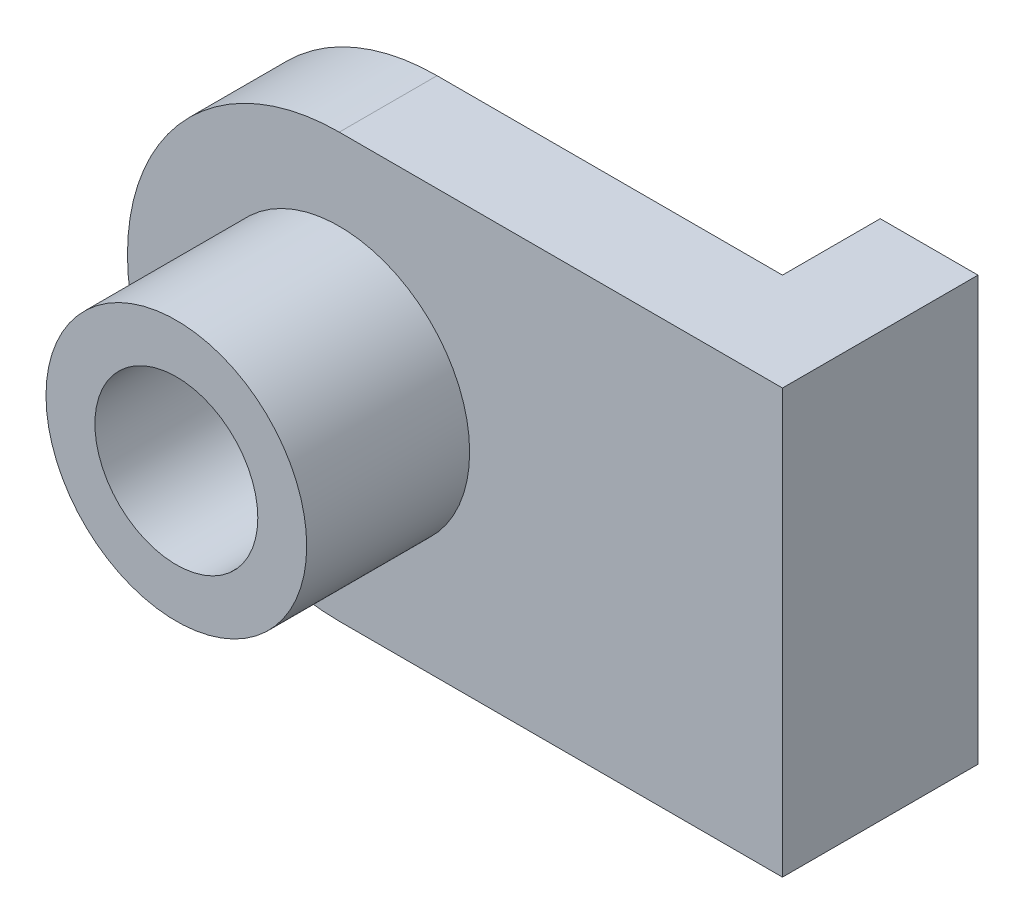
from build123d import *

# Parameters (mm, degrees)
BOSS_EXTRUDE1_DEPTH = 381
SKETCH2_R           = 508
BOSS_EXTRUDE2_DEPTH = 635
SKETCH3_R           = 317.5
CUT_EXTRUDE1_DEPTH  = 2597.3968957
SKETCH4_W           = 381
SKETCH4_H           = 1651
BOSS_EXTRUDE3_DEPTH = 381


with BuildPart() as part:
    # Sketch1 → Boss-Extrude1 (new body)
    with BuildSketch(Plane.XY):
        with BuildLine():
            Line((0, 0), (1727.2, 0))
            Line((1727.2, 0), (1727.2, 1651))
            Line((1727.2, 1651), (0, 1651))
            ThreePointArc((0, 1651), (-825.5, 825.5), (0, 0))
        make_face()
    extrude(amount=BOSS_EXTRUDE1_DEPTH)

    # Sketch2 → Boss-Extrude2 (add)
    with BuildSketch(Plane.XY.offset(381)):
        with Locations((0, 825.5)):
            Circle(SKETCH2_R)
    extrude(amount=BOSS_EXTRUDE2_DEPTH)

    # Sketch3 → Cut-Extrude1 (cut, through all)
    with BuildSketch(Plane.XY.offset(1016)):
        with Locations((0, 825.5)):
            Circle(SKETCH3_R)
    extrude(amount=-CUT_EXTRUDE1_DEPTH, mode=Mode.SUBTRACT)

    # Sketch4 → Boss-Extrude3 (add)
    with BuildSketch(Plane(origin=(0, 0, 0), x_dir=(-1, 0, 0), z_dir=(0, 0, -1))):
        with Locations((-1536.7, 825.5)):
            Rectangle(SKETCH4_W, SKETCH4_H)
    extrude(amount=BOSS_EXTRUDE3_DEPTH)


solid = part.part
